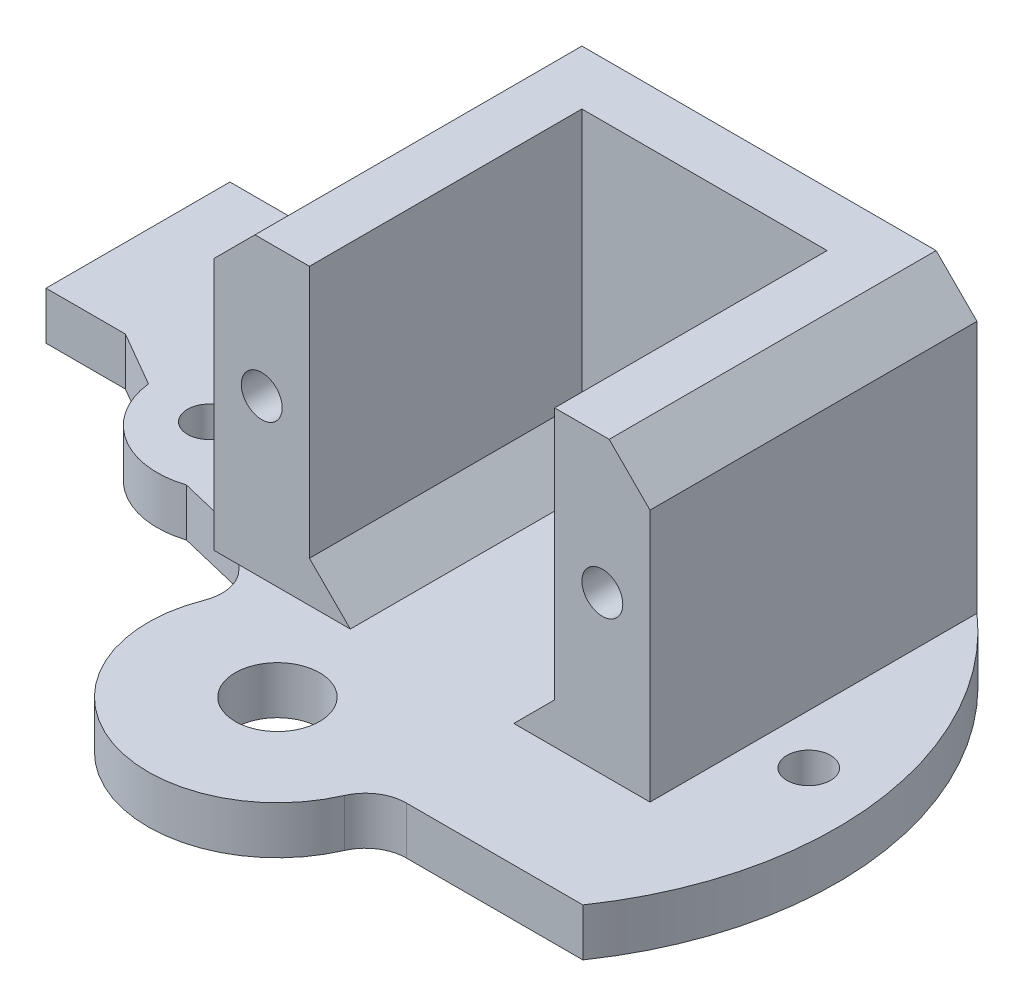
from build123d import *
from build123d.topology import SkipClean

# Parameters (mm, degrees)
CROQUIS1_W              = 70
CROQUIS1_H              = 65
EXTRUIR1_DEPTH          = 3.5
CROQUIS2_R              = 3.1
EXTRUIR2_DEPTH          = 5
EXTRUIR3_DEPTH          = 10
CROQUIS4_OUTSIDE_W      = 91.294
CROQUIS4_OUTSIDE_H      = 86.294
EXTRUIR4_DEPTH          = 10
REDONDEO1_R             = 3
EXTRUIR5_DEPTH          = 13.5
EXTRUIR6_DEPTH          = 3.5
CROQUIS7_R              = 1.6
EXTRUIR7_DEPTH          = 47.982330447
CROQUIS8_R              = 3.1
EXTRUIR8_DEPTH          = 5
CROQUIS9_W              = 0.7
CROQUIS9_H              = 10.5
EXTRUIR9_DEPTH          = 10
EXTRUIR10_DEPTH         = 63.752948337
EXTRUIR10_DEPTH_BACK    = 10
CROQUIS10_W             = 3.0625
CROQUIS10_H             = 5
CROQUIS11_W             = 54.8364
CROQUIS11_H             = 30
SALIENTE_EXTRUIR1_DEPTH = 4
CROQUIS13_W             = 7
CROQUIS13_H             = 30
SALIENTE_EXTRUIR2_DEPTH = 20
CORTAR_EXTRUIR1_DEPTH   = 8.44
CROQUIS15_W             = 22.8364
CROQUIS15_H             = 21.56
CORTAR_EXTRUIR2_DEPTH   = 8.44
CHAFL_N2_SIZE           = 3
CROQUIS16_R             = 1.5
CORTAR_EXTRUIR3_DEPTH   = 58.02817702
CHAFL_N3_SIZE           = 3


with BuildPart() as part:
    # Croquis1 → Extruir1 (new body)
    with BuildSketch(Plane(origin=(0, 0, 0), x_dir=(1, 0, 0), z_dir=(0, 1, 0))):
        Rectangle(CROQUIS1_W, CROQUIS1_H)
    extrude(amount=EXTRUIR1_DEPTH)

    # Croquis2 → Extruir2 (cut)
    with BuildSketch(Plane(origin=(0, 3.5, 0), x_dir=(1, 0, 0), z_dir=(0, 1, 0))):
        with Locations(Location((0, -17.5, 0), (0, 0, 270))):
            Circle(CROQUIS2_R)
    extrude(amount=-EXTRUIR2_DEPTH, mode=Mode.SUBTRACT)

    # Croquis3 → Extruir3 (add)
    with BuildSketch(Plane(origin=(0, 3.5, 0), x_dir=(1, 0, 0), z_dir=(0, 1, 0))):
        with BuildLine():
            Line((-34.4868, 13.5), (20.3496, 13.5))
            Line((20.3496, 13.5), (20.3496, 0))
            Line((20.3496, 0), (17.146428199, 0))
            ThreePointArc((17.146428199, 0), (22.955777517, -8.939493087), (24.418230894, -19.5))
            Line((24.418230894, -19.5), (9.287087811, -19.5))
            ThreePointArc((9.287087811, -19.5), (-3.635492607, -26.276855559), (-7.981176331, -12.347250794))
            Line((-7.981176331, -12.347250794), (-18.680510212, -1.647916913))
            ThreePointArc((-18.680510212, -1.647916913), (-17.932408832, -0.806327142), (-17.146428199, 0))
            Line((-17.146428199, 0), (-34.4868, 0))
            Line((-34.4868, 0), (-34.4868, 13.5))
        make_face()
        with BuildLine():
            Line((-32.9868, 1.5), (-12.961481397, 1.5))
            ThreePointArc((-12.961481397, 1.5), (-14.868021343, 0.048274597), (-16.613165932, -1.593940849))
            Line((-16.613165932, -1.593940849), (-5.999348286, -12.207758495))
            ThreePointArc((-5.999348286, -12.207758495), (-3.061467459, -24.89103626), (7.984359711, -18))
            Line((7.984359711, -18), (22.994564575, -18))
            ThreePointArc((22.994564575, -18), (20.451694563, -6.977253708), (12.961481397, 1.5))
            Line((12.961481397, 1.5), (18.8496, 1.5))
            Line((18.8496, 1.5), (18.8496, 12))
            Line((18.8496, 12), (-32.9868, 12))
            Line((-32.9868, 12), (-32.9868, 1.5))
        make_face(mode=Mode.SUBTRACT)
    extrude(amount=EXTRUIR3_DEPTH)

    # Croquis4 outside → Extruir4 (cut)
    with SkipClean():  # the faces are left unmerged after this step: merging them gives an invalid solid
        with BuildSketch(Plane(origin=(0, 3.5, 0), x_dir=(1, 0, 0), z_dir=(0, 1, 0))):
            Rectangle(CROQUIS4_OUTSIDE_W, CROQUIS4_OUTSIDE_H)
            with BuildLine():
                Line((-34.4868, 0), (-17.146428199, 0))
                ThreePointArc((-17.146428199, 0), (-17.932408832, -0.806327142), (-18.680510212, -1.647916913))
                Line((-18.680510212, -1.647916913), (-7.981176331, -12.347250794))
                ThreePointArc((-7.981176331, -12.347250794), (-3.635492607, -26.276855559), (9.287087811, -19.5))
                Line((9.287087811, -19.5), (24.418230894, -19.5))
                ThreePointArc((24.418230894, -19.5), (22.955777517, -8.939493087), (17.146428199, 0))
                Line((17.146428199, 0), (20.3496, 0))
                Line((20.3496, 0), (20.3496, 13.5))
                Line((20.3496, 13.5), (-34.4868, 13.5))
                Line((-34.4868, 13.5), (-34.4868, 0))
            make_face(mode=Mode.SUBTRACT)
        extrude(amount=-EXTRUIR4_DEPTH, mode=Mode.SUBTRACT)

    # Redondeo1
    redondeo1_edges = [part.edges().sort_by_distance(p)[0] for p in [
        (-7.981176331, 8.5, 12.347250794),
        (9.287087811, 8.5, 19.5),
        (-5.999348286, 8.5, 12.207758495),
        (7.984359711, 8.5, 18),
    ]]
    fillet(redondeo1_edges, radius=REDONDEO1_R)

    # Croquis5 → Extruir5 (add)
    with SkipClean():  # the faces are left unmerged after this step: merging them gives an invalid solid
        with BuildSketch(Plane.XZ):
            with BuildLine():
                Line((-18.680510212, 1.647916913), (-14.437869525, 5.8905576))
                ThreePointArc((-14.437869525, 5.8905576), (-21.723092903, 6.819250451), (-24.449770984, 0))
                Line((-24.449770984, 0), (-17.146428199, 0))
                ThreePointArc((-17.146428199, 0), (-17.932408832, 0.806327142), (-18.680510212, 1.647916913))
            make_face()
            with BuildLine():
                Line((20.3496, 0), (20.3496, -13.5))
                ThreePointArc((20.3496, -13.5), (28.665212431, 2.225567304), (24.418230894, 19.5))
                ThreePointArc((24.418230894, 19.5), (22.955777517, 8.939493087), (17.146428199, 0))
                Line((17.146428199, 0), (20.3496, 0))
            make_face()
        extrude(amount=-EXTRUIR5_DEPTH)

    # Chaflán1
    # the kernel refuses this chamfer: 5, 4.044665138 mm, written as the material it adds along each edge
    with BuildSketch(Plane(origin=(-14.437869525, 3.5, 5.8905576), x_dir=(-0.8768595348589335, 0, 0.48074666522709736), z_dir=(0, 1, 0))) as chafl_n1_piece_1:
        with BuildLine():
            Line((2.949791971, 0), (-1.211824758, 3.780414953))
            Line((-1.211824758, 3.780414953), (-1.307822013, 3.752405544))
            ThreePointArc((-1.307822013, 3.752405544), (-0.651776703, 1.876825504), (-0.095997255, -0.02800941))
            Line((-0.095997255, -0.02800941), (0.02800941, -0.095997255))
            ThreePointArc((0.02800941, -0.095997255), (1.47002525, 0.136406993), (2.931105495, -0.098238565))
            Line((2.931105495, -0.098238565), (2.949791971, 0))
        make_face()
    extrude(amount=10)
    with BuildSketch(Plane(origin=(-24.449770984, 3.5, 0), x_dir=(-0.00803680374358312, 0, 0.9999677043712897), z_dir=(0, 1, 0))) as chafl_n1_piece_2:
        with BuildLine():
            Line((2.423263449, 0), (-0.064845869, -4.38542071))
            Line((-0.064845869, -4.38542071), (-0.164842639, -4.386224391))
            ThreePointArc((-0.164842639, -4.386224391), (-0.082377051, -2.193111839), (-0.09999677, -0.00080368))
            Line((-0.09999677, -0.00080368), (0.026691621, 0.096371974))
            ThreePointArc((0.026691621, 0.096371974), (1.204598314, -0.104316531), (2.411212242, 0.099271186))
            Line((2.411212242, 0.099271186), (2.423263449, 0))
        make_face()
    extrude(amount=10)
    with BuildSketch(Plane(origin=(-24.449770984, 0, 0), x_dir=(-0.9997395779240649, 0, -0.022820524363231547), z_dir=(0, 1, 0))) as chafl_n1_piece_3:
        with BuildLine():
            Line((4.385900112, 0), (-0.035828136, 2.422998574))
            Line((-0.035828136, 2.422998574), (-0.134910293, 2.409480951))
            ThreePointArc((-0.134910293, 2.409480951), (0.08649505, 1.206008973), (-0.096756078, 0.025263837))
            Line((-0.096756078, 0.025263837), (0.002282052, -0.099973958))
            ThreePointArc((0.002282052, -0.099973958), (2.194090072, -0.04994272), (4.388182164, -0.099973958))
            Line((4.388182164, -0.099973958), (4.385900112, 0))
        make_face()
    extrude(amount=3.5)
    with BuildSketch(Plane(origin=(-14.437869525, 0, 5.8905576), x_dir=(0.7254657554746629, 0, 0.6882582637597435), z_dir=(0, 1, 0))) as chafl_n1_piece_4:
        with BuildLine():
            Line((3.96989376, 0), (-0.900434913, -2.809001538))
            Line((-0.900434913, -2.809001538), (-0.98828054, -2.761219262))
            ThreePointArc((-0.98828054, -2.761219262), (-0.318834214, -1.441501248), (-0.099965384, 0.002630967))
            Line((-0.099965384, 0.002630967), (0.002630967, 0.099965384))
            ThreePointArc((0.002630967, 0.099965384), (1.986203869, 0.047760165), (3.972524727, 0.099965384))
            Line((3.972524727, 0.099965384), (3.96989376, 0))
        make_face()
    extrude(amount=3.5)


with BuildPart() as body_2:
    # Croquis6 → Extruir6 (new body)
    with BuildSketch(Plane(origin=(0, 13.5, 0), x_dir=(1, 0, 0), z_dir=(0, 1, 0))):
        with BuildLine():
            Line((-34.4868, 13.5), (-34.4868, 0))
            Line((-34.4868, 0), (-28.661374979, 0))
            Line((-28.661374979, 0), (-24.642400208, -2.323096648))
            ThreePointArc((-24.642400208, -2.323096648), (-21.929637735, -6.692039268), (-16.829963308, -7.355409896))
            Line((-16.829963308, -7.355409896), (-11.752306982, -8.576120143))
            Line((-11.752306982, -8.576120143), (-9.515139435, -10.813287689))
            ThreePointArc((-9.515139435, -10.813287689), (-8.69974084, -12.321679102), (-8.843709432, -14.030302105))
            ThreePointArc((-8.843709432, -14.030302105), (-3.635492607, -26.276855559), (8.70689382, -21.3))
            ThreePointArc((8.70689382, -21.3), (9.813271565, -19.99001992), (11.456439237, -19.5))
            Line((11.456439237, -19.5), (24.418230894, -19.5))
            ThreePointArc((24.418230894, -19.5), (28.665212431, -2.225567304), (20.3496, 13.5))
            Line((20.3496, 13.5), (-34.4868, 13.5))
        make_face()
    extrude(amount=EXTRUIR6_DEPTH)


with BuildPart() as extruir7_tool:
    # Croquis7 → Extruir7 (new, through all)
    with BuildSketch(Plane(origin=(0, 17, 0), x_dir=(1, 0, 0), z_dir=(0, 1, 0))):
        with Locations(Location((-20, -2.5, 0), (0, 0, 270))):
            Circle(CROQUIS7_R)
        with Locations(Location((24, -2.5, 0), (0, 0, 270))):
            Circle(CROQUIS7_R)
    extrude(amount=-EXTRUIR7_DEPTH)


with BuildPart() as part_1:
    add(part.part)

    # Extruir7: cut by extruir7_tool
    add(extruir7_tool.part, mode=Mode.SUBTRACT)

    # Croquis9 → Extruir9 (cut)
    with BuildSketch(Plane(origin=(0, 13.5, 0), x_dir=(1, 0, 0), z_dir=(0, 1, 0))):
        with Locations((19.1996, 6.75)):
            Rectangle(CROQUIS9_W, CROQUIS9_H)
    extrude(amount=-EXTRUIR9_DEPTH, mode=Mode.SUBTRACT)

    # Croquis10 → Extruir10 (cut, two sides: drawn at the far end of the back side and taken through both)
    with BuildSketch(Plane.ZY.offset(-19.5496).offset(-EXTRUIR10_DEPTH_BACK)):
        with Locations((-8.9375, 8.5)):
            Rectangle(CROQUIS10_W, CROQUIS10_H)
    extrude(amount=EXTRUIR10_DEPTH + EXTRUIR10_DEPTH_BACK, mode=Mode.SUBTRACT)


with BuildPart() as body_2_1:
    add(body_2.part)

    # Extruir7: cut by extruir7_tool
    add(extruir7_tool.part, mode=Mode.SUBTRACT)

    # Croquis8 → Extruir8 (cut)
    with BuildSketch(Plane(origin=(0, 17, 0), x_dir=(1, 0, 0), z_dir=(0, 1, 0))):
        with Locations(Location((0, -17.5, 0), (0, 0, 270))):
            Circle(CROQUIS8_R)
    extrude(amount=-EXTRUIR8_DEPTH, mode=Mode.SUBTRACT)

    # Croquis11 → Saliente-Extruir1 (add)
    with BuildSketch(Plane(origin=(0, 0, -13.5), x_dir=(-1, 0, 0), z_dir=(0, 0, -1))):
        with Locations((7.0686, 32)):
            Rectangle(CROQUIS11_W, CROQUIS11_H)
    extrude(amount=-SALIENTE_EXTRUIR1_DEPTH)

    # Croquis13 → Saliente-Extruir2 (add)
    with BuildSketch(Plane.XY.offset(-9.5)):
        with Locations((-8.1504, 32)):
            Rectangle(CROQUIS13_W, CROQUIS13_H)
        with Locations((16.8496, 32)):
            Rectangle(CROQUIS13_W, CROQUIS13_H)
    extrude(amount=SALIENTE_EXTRUIR2_DEPTH)

    # Croquis14 → Cortar-Extruir1 (cut)
    with BuildSketch(Plane(origin=(0, 47, 0), x_dir=(1, 0, 0), z_dir=(0, 1, 0))):
        Polygon((20.3496, 13.5), (-34.4868, 13.5), (-34.4868, 9.5), (-11.6504, 9.5), (-11.6504, -10.5), (-4.6504, -10.5), (-4.6504, 9.5), (13.3496, 9.5), (13.3496, -10.5), (20.3496, -10.5), align=None)
    extrude(amount=-CORTAR_EXTRUIR1_DEPTH, mode=Mode.SUBTRACT)

    # Croquis15 → Cortar-Extruir2 (cut)
    with BuildSketch(Plane.XY.offset(-9.5)):
        with Locations((-23.0686, 27.78)):
            Rectangle(CROQUIS15_W, CROQUIS15_H)
    extrude(amount=-CORTAR_EXTRUIR2_DEPTH, mode=Mode.SUBTRACT)

    # Chaflán2
    chafl_n2_edges = [body_2_1.edges().sort_by_distance(p)[0] for p in [
        (-4.6504, 17, 0.5),
        (4.3496, 17, -9.5),
        (13.3496, 17, 0.5),
    ]]
    chamfer(chafl_n2_edges, length=CHAFL_N2_SIZE)

    # Croquis16 → Cortar-Extruir3 (cut, through all)
    with BuildSketch(Plane.XY.offset(10.5)):
        with Locations((-8.1504, 28.56)):
            Circle(CROQUIS16_R)
        with Locations((16.8496, 28.56)):
            Circle(CROQUIS16_R)
    extrude(amount=-CORTAR_EXTRUIR3_DEPTH, mode=Mode.SUBTRACT)

    # Chaflán3
    chafl_n3_edges = [body_2_1.edges().sort_by_distance(p)[0] for p in [
        (20.3496, 38.56, -1.5),
        (-11.6504, 38.56, -1.5),
    ]]
    chamfer(chafl_n3_edges, length=CHAFL_N3_SIZE)


solid = body_2_1.part
